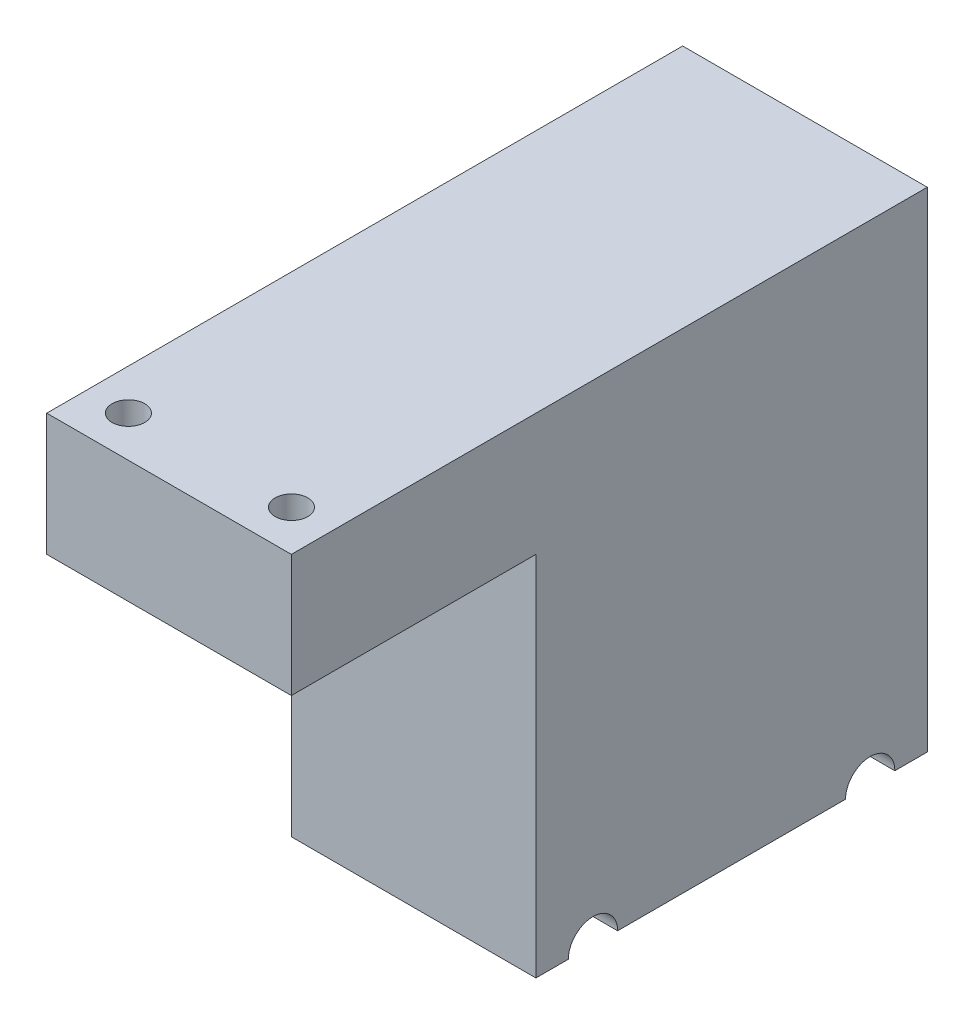
from build123d import *

# Parameters (mm, degrees)
SKETCH_1_W          = 30
SKETCH_1_H          = 95
EXTRUDE_1_DEPTH     = 48
SKETCH_2_R          = 3.025
SKETCH_2_R_2        = 3.005
CUT_EXTRUDE_1_DEPTH = 46
SKETCH_3_W          = 30
SKETCH_3_H          = 15
EXTRUDE_2_DEPTH     = 30
SKETCH_4_R          = 2
CUT_EXTRUDE_2_DEPTH = 5
SKETCH_5_W          = 48
SKETCH_5_H          = 35
CUT_EXTRUDE_3_DEPTH = 127.526677029
SKETCH_6_R          = 2
CUT_EXTRUDE_4_DEPTH = 5


with BuildPart() as part:
    # 草图1 → 凸台-拉伸1 (new body)
    with BuildSketch(Plane.XY):
        with Locations((15, 47.5)):
            Rectangle(SKETCH_1_W, SKETCH_1_H)
    extrude(amount=EXTRUDE_1_DEPTH)

    # 草图2 → 切除-拉伸1 (cut)
    # profile 1 of 2: a face of its own
    with BuildSketch(Plane.ZY):
        with Locations((7, 35)):
            Circle(SKETCH_2_R)
        with Locations((7, 35)):
            Circle(SKETCH_2_R_2, mode=Mode.SUBTRACT)
    # profile 2 of 2: a face of its own
    with BuildSketch(Plane.ZY):
        with Locations((41, 35)):
            Circle(SKETCH_2_R)
        with Locations((41, 35)):
            Circle(SKETCH_2_R_2, mode=Mode.SUBTRACT)
    extrude(amount=-CUT_EXTRUDE_1_DEPTH, mode=Mode.SUBTRACT)


with BuildPart() as cut_extrude_1_kept_piece:
    # of the separate pieces the step leaves, the one the design keeps (cut_extrude_1_pieces_kept)
    add(part.part.solids().sort_by_distance((0, 0, 0))[0])

    # 草图3 → 凸台-拉伸2 (add)
    with BuildSketch(Plane.XY.offset(48)):
        with Locations((15, 87.5)):
            Rectangle(SKETCH_3_W, SKETCH_3_H)
    extrude(amount=EXTRUDE_2_DEPTH)

    # 草图4 → 切除-拉伸2 (cut)
    with BuildSketch(Plane(origin=(0, 95, 0), x_dir=(1, 0, 0), z_dir=(0, 1, 0))):
        with Locations((5, -72.983651548)):
            Circle(SKETCH_4_R)
        with Locations((25, -72.983651548)):
            Circle(SKETCH_4_R)
    extrude(amount=-CUT_EXTRUDE_2_DEPTH, mode=Mode.SUBTRACT)

    # 草图5 → 切除-拉伸3 (cut, through all)
    with BuildSketch(Plane.ZY):
        with Locations((24, 17.5)):
            Rectangle(SKETCH_5_W, SKETCH_5_H)
    extrude(amount=-CUT_EXTRUDE_3_DEPTH, mode=Mode.SUBTRACT)

    # 草图6 → 切除-拉伸4 (cut)
    with BuildSketch(Plane.XZ.offset(-35)):
        with Locations((6, 31.975)):
            Circle(SKETCH_6_R)
        with Locations((24, 31.975)):
            Circle(SKETCH_6_R)
        with Locations((6, 16.025)):
            Circle(SKETCH_6_R)
        with Locations((24, 16.025)):
            Circle(SKETCH_6_R)
    extrude(amount=-CUT_EXTRUDE_4_DEPTH, mode=Mode.SUBTRACT)


solid = cut_extrude_1_kept_piece.part
